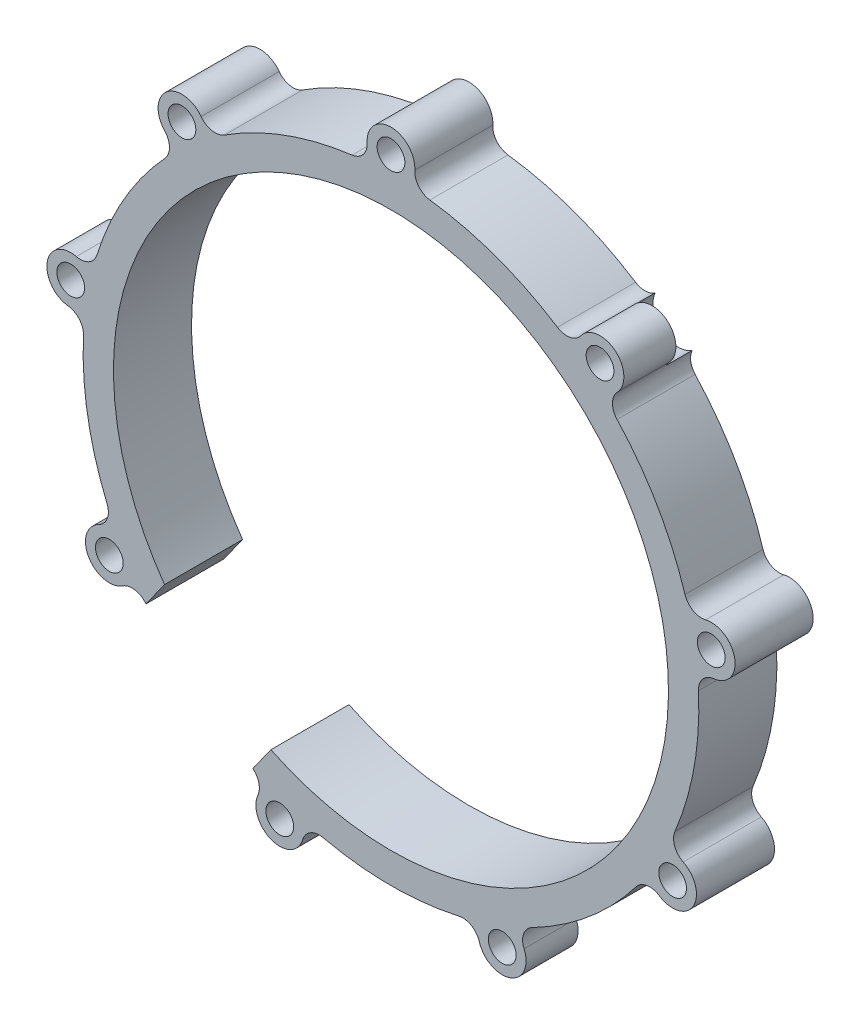
from build123d import *

# Parameters (mm, degrees)
SKETCH_1_R          = 35.5
SKETCH_1_R_2        = 32
SKETCH_1_R_3        = 1.6
EXTRUDE_1_DEPTH     = 9
SKETCH_2_R          = 2.9
CUT_EXTRUDE_1_DEPTH = 3
CUT_EXTRUDE_3_DEPTH = 58.232752625
FILLET_START        = -1
FILLET_1_DEPTH      = 11


with BuildPart() as part:
    # 草图1 → 凸台-拉伸1 (new body)
    # profile 1 of 10: a face of its own
    with BuildSketch(Plane.XY):
        Circle(SKETCH_1_R)
        Circle(SKETCH_1_R_2, mode=Mode.SUBTRACT)
    # profile 2 of 10: a face of its own
    with BuildSketch(Plane.XY):
        with BuildLine():
            ThreePointArc((-26.073632516, 24.091817852), (-22.818960144, 27.194577731), (-19.198170234, 29.861015717))
            ThreePointArc((-19.198170234, 29.861015717), (-20.642400342, 29.576478726), (-21.890190162, 30.357364422))
            ThreePointArc((-21.890190162, 30.357364422), (-25.87220129, 30.833288836), (-26.094976213, 26.829129998))
            ThreePointArc((-26.094976213, 26.829129998), (-25.542630354, 25.46469753), (-26.073632516, 24.091817852))
        make_face()
        with Locations((-24.104535363, 28.726666617)):
            Circle(SKETCH_1_R_3, mode=Mode.SUBTRACT)
    # profile 3 of 10: a face of its own
    with BuildSketch(Plane.XY):
        with BuildLine():
            ThreePointArc((-4.48763929, 35.215211111), (0, 35.5), (4.48763929, 35.215211111))
            ThreePointArc((4.48763929, 35.215211111), (3.198397989, 35.925576349), (2.744479181, 37.325833333))
            ThreePointArc((2.744479181, 37.325833333), (0, 40.25), (-2.744479181, 37.325833333))
            ThreePointArc((-2.744479181, 37.325833333), (-3.198397989, 35.925576349), (-4.48763929, 35.215211111))
        make_face()
        with Locations((0, 37.5)):
            Circle(SKETCH_1_R_3, mode=Mode.SUBTRACT)
    # profile 4 of 10: a face of its own
    with BuildSketch(Plane.XY):
        with BuildLine():
            ThreePointArc((19.198170234, 29.861015717), (22.818960144, 27.194577731), (26.073632516, 24.091817852))
            ThreePointArc((26.073632516, 24.091817852), (25.542630354, 25.46469753), (26.094976213, 26.829129998))
            ThreePointArc((26.094976213, 26.829129998), (25.87220129, 30.833288836), (21.890190162, 30.357364422))
            ThreePointArc((21.890190162, 30.357364422), (20.642400342, 29.576478726), (19.198170234, 29.861015717))
        make_face()
        with Locations((24.104535363, 28.726666617)):
            Circle(SKETCH_1_R_3, mode=Mode.SUBTRACT)
    # profile 5 of 10: a face of its own
    with BuildSketch(Plane.XY):
        with BuildLine():
            ThreePointArc((33.900942541, 10.534519201), (34.960675232, 6.164510307), (35.459483311, 1.69559527))
            ThreePointArc((35.459483311, 1.69559527), (35.935182102, 3.088603728), (37.235343863, 3.778778563))
            ThreePointArc((37.235343863, 3.778778563), (39.638512059, 6.989339151), (36.282196246, 9.184347313))
            ThreePointArc((36.282196246, 9.184347313), (34.824390138, 9.388218001), (33.900942541, 10.534519201))
        make_face()
        with Locations((36.930290738, 6.511806663)):
            Circle(SKETCH_1_R_3, mode=Mode.SUBTRACT)
    # profile 6 of 10: a face of its own
    with BuildSketch(Plane.XY):
        with BuildLine():
            ThreePointArc((33.697359474, -16.286127976), (32.711660758, -15.192894265), (32.741087067, -13.721195927))
            ThreePointArc((32.741087067, -13.721195927), (30.743901834, -17.75), (28.253447777, -21.494015184))
            ThreePointArc((28.253447777, -21.494015184), (29.51326277, -20.732682084), (30.952880294, -21.039705357))
            ThreePointArc((30.952880294, -21.039705357), (34.857522502, -20.125), (33.697359474, -16.286127976))
        make_face()
        with Locations((32.475952642, -18.75)):
            Circle(SKETCH_1_R_3, mode=Mode.SUBTRACT)
    # profile 7 of 10: a face of its own
    with BuildSketch(Plane.XY):
        with BuildLine():
            ThreePointArc((15.3451537, -34.136142985), (15.29278176, -32.665082454), (16.261313077, -31.556610987))
            ThreePointArc((16.261313077, -31.556610987), (12.141715088, -33.359088038), (7.827310026, -34.626337054))
            ThreePointArc((7.827310026, -34.626337054), (9.281759784, -34.852915531), (10.187220033, -36.013477311))
            ThreePointArc((10.187220033, -36.013477311), (13.766310769, -37.822627987), (15.3451537, -34.136142985))
        make_face()
        with Locations((12.825755375, -35.238473279)):
            Circle(SKETCH_1_R_3, mode=Mode.SUBTRACT)
    # profile 8 of 10: a face of its own
    with BuildSketch(Plane.XY):
        with BuildLine():
            ThreePointArc((-10.187220033, -36.013477311), (-9.281759784, -34.852915531), (-7.827310026, -34.626337054))
            ThreePointArc((-7.827310026, -34.626337054), (-12.141715088, -33.359088038), (-16.261313077, -31.556610987))
            ThreePointArc((-16.261313077, -31.556610987), (-15.29278176, -32.665082454), (-15.3451537, -34.136142985))
            ThreePointArc((-15.3451537, -34.136142985), (-13.766310769, -37.822627987), (-10.187220033, -36.013477311))
        make_face()
        with Locations((-12.825755375, -35.238473279)):
            Circle(SKETCH_1_R_3, mode=Mode.SUBTRACT)
    # profile 9 of 10: a face of its own
    with BuildSketch(Plane.XY):
        with BuildLine():
            ThreePointArc((-30.952880294, -21.039705357), (-29.51326277, -20.732682084), (-28.253447777, -21.494015184))
            ThreePointArc((-28.253447777, -21.494015184), (-30.743901834, -17.75), (-32.741087067, -13.721195927))
            ThreePointArc((-32.741087067, -13.721195927), (-32.711660758, -15.192894265), (-33.697359474, -16.286127976))
            ThreePointArc((-33.697359474, -16.286127976), (-34.857522502, -20.125), (-30.952880294, -21.039705357))
        make_face()
        with Locations((-32.475952642, -18.75)):
            Circle(SKETCH_1_R_3, mode=Mode.SUBTRACT)
    # profile 10 of 10: a face of its own
    with BuildSketch(Plane.XY):
        with BuildLine():
            ThreePointArc((-35.459483311, 1.69559527), (-34.960675232, 6.164510307), (-33.900942541, 10.534519201))
            ThreePointArc((-33.900942541, 10.534519201), (-34.824390138, 9.388218001), (-36.282196246, 9.184347313))
            ThreePointArc((-36.282196246, 9.184347313), (-39.638512059, 6.989339151), (-37.235343863, 3.778778563))
            ThreePointArc((-37.235343863, 3.778778563), (-35.935182102, 3.088603728), (-35.459483311, 1.69559527))
        make_face()
        with Locations((-36.930290738, 6.511806663)):
            Circle(SKETCH_1_R_3, mode=Mode.SUBTRACT)
    extrude(amount=EXTRUDE_1_DEPTH)

    # 草图2 → 切除-拉伸1 (cut)
    with BuildSketch(Plane(origin=(0, 0, 0), x_dir=(-1, 0, 0), z_dir=(0, 0, -1))):
        with Locations((36.930290738, 6.511806663)):
            Circle(SKETCH_2_R)
        with Locations((-12.825755375, -35.238473279)):
            Circle(SKETCH_2_R)
        with Locations((-24.104535363, 28.726666617)):
            Circle(SKETCH_2_R)
    extrude(amount=-CUT_EXTRUDE_1_DEPTH, mode=Mode.SUBTRACT)

    # 草图4 → 切除-拉伸3 (cut, through all)
    with BuildSketch(Plane(origin=(0, 0, 0), x_dir=(-1, 0, 0), z_dir=(0, 0, -1))):
        with BuildLine():
            Line((15.906018141, -31.737179883), (13.847443054, -28.848714371))
            ThreePointArc((13.847443054, -28.848714371), (20.641141261, -24.45287892), (26.114981508, -18.493451297))
            Line((26.114981508, -18.493451297), (28.253447777, -21.494015184))
            ThreePointArc((28.253447777, -21.494015184), (22.665948321, -27.322239782), (15.906018141, -31.737179883))
        make_face()
    extrude(amount=-CUT_EXTRUDE_3_DEPTH, mode=Mode.SUBTRACT)

    # 圆角1: read off the stored shape, not the designer's step
    # 圆角1 outline → 圆角1 (cut)
    with BuildSketch(Plane.XY.offset(FILLET_START)):
        with BuildLine():
            ThreePointArc((-16.261313077, -31.556610987), (-15.974969952, -31.736306296), (-15.722982331, -31.961661634))
            ThreePointArc((-15.722982331, -31.961661634), (-15.818569327, -31.852738575), (-15.906018141, -31.737179883))
            ThreePointArc((-15.906018141, -31.737179883), (-16.083919009, -31.647394036), (-16.261313077, -31.556610987))
        make_face()
    extrude(amount=FILLET_1_DEPTH, mode=Mode.SUBTRACT)


solid = part.part
